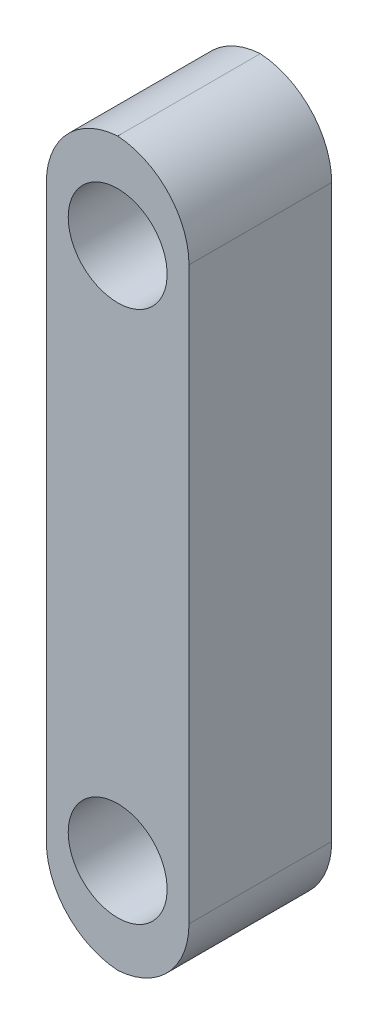
from build123d import *

# Parameters (mm, degrees)
SKETCH1_W           = 9.525
SKETCH1_H           = 48.26
SKETCH1_R           = 3.302
BOSS_EXTRUDE1_DEPTH = 9.525
FILLET1_R           = 5.08


with BuildPart() as part:
    # Sketch1 → Boss-Extrude1 (new body)
    with BuildSketch(Plane.XY):
        Rectangle(SKETCH1_W, SKETCH1_H)
        with Locations(Location((0, -17.78, 0), (0, 0, 180))):
            Circle(SKETCH1_R, mode=Mode.SUBTRACT)
        with Locations(Location((0, 17.78, 0), (0, 0, 180))):
            Circle(SKETCH1_R, mode=Mode.SUBTRACT)
    extrude(amount=BOSS_EXTRUDE1_DEPTH)

    # Fillet1
    # the kernel refuses this fillet: 5.08 mm, written as the material it takes off along each edge
    with BuildSketch(Plane(origin=(-4.7625, -24.13, -12.7), x_dir=(1, 0, 0), z_dir=(0, 0, 1)), Plane(origin=(4.7625, -24.13, -12.7), x_dir=(0, 1, 0), z_dir=(0, 0, 1)), Plane(origin=(4.7625, 24.13, -12.7), x_dir=(-1, 0, 0), z_dir=(0, 0, 1))) as fillet1_piece_1:
        with BuildLine():
            CenterArc((FILLET1_R, FILLET1_R), FILLET1_R, 180, 90)
            Line((0, FILLET1_R), (0, 0))
            Line((0, 0), (FILLET1_R, 0))
        make_face()
    extrude(amount=34.925, mode=Mode.SUBTRACT)
    with BuildSketch(Plane(origin=(-4.7625, 24.13, -12.7), x_dir=(1, 0, 0), z_dir=(0, 0, 1))) as fillet1_piece_2:
        with BuildLine():
            CenterArc((FILLET1_R, -FILLET1_R), FILLET1_R, 90, 90)
            Line((0, -FILLET1_R), (0, 0))
            Line((0, 0), (FILLET1_R, 0))
        make_face()
    extrude(amount=34.925, mode=Mode.SUBTRACT)


solid = part.part
